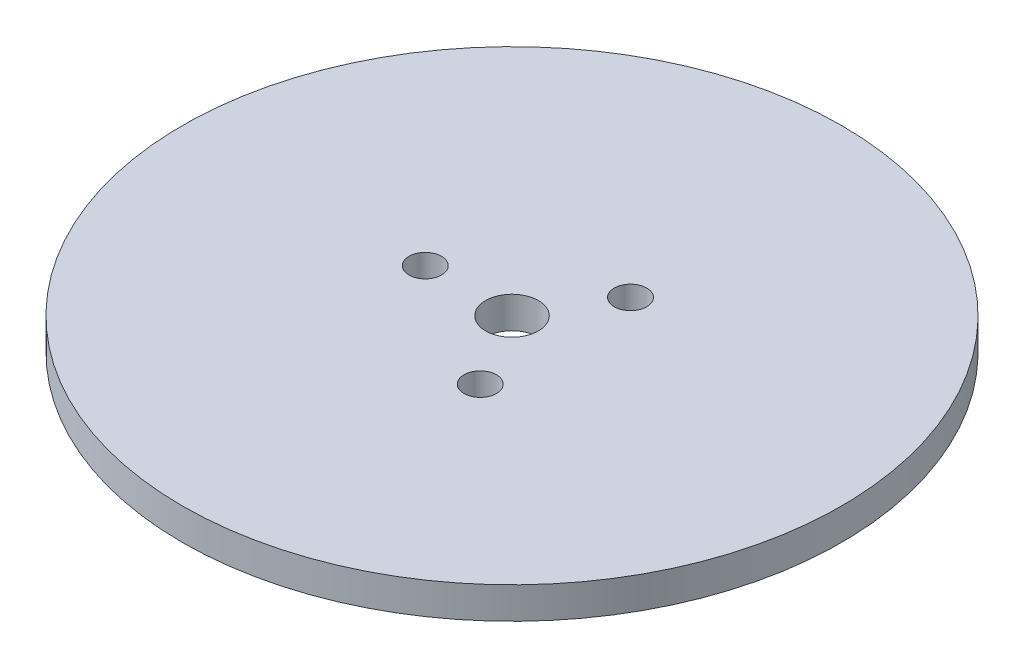
from build123d import *

# Parameters (mm, degrees)
SKETCH1_R           = 62.5
BOSS_EXTRUDE1_DEPTH = 6
SKETCH2_R           = 5
CUT_EXTRUDE1_DEPTH  = 89.591760339
SKETCH3_R           = 3.082357368
CUT_EXTRUDE2_DEPTH  = 4.412340898
CIRPATTERN1_COUNT   = 3


with BuildPart() as part:
    # Sketch1 → Boss-Extrude1 (new body)
    with BuildSketch(Plane(origin=(0, 0, 0), x_dir=(1, 0, 0), z_dir=(0, 1, 0))):
        Circle(SKETCH1_R)
    extrude(amount=BOSS_EXTRUDE1_DEPTH)

    # Sketch2 → Cut-Extrude1 (cut, through all)
    with BuildSketch(Plane(origin=(0, 0, 0), x_dir=(1, 0, 0), z_dir=(0, 1, 0))):
        Circle(SKETCH2_R)
    extrude(amount=CUT_EXTRUDE1_DEPTH, mode=Mode.SUBTRACT)

    # Sketch3 → Cut-Extrude2 (cut)
    with BuildSketch(Plane(origin=(0, 6, 0), x_dir=(1, 0, 0), z_dir=(0, 1, 0))):
        with Locations((-16.448886968, 0)):
            Circle(SKETCH3_R)
    cut_extrude2 = extrude(amount=-CUT_EXTRUDE2_DEPTH, mode=Mode.SUBTRACT)

    # CirPattern1: Cut-Extrude2 ×3 about axis
    cirpattern1_axis = Axis((0, 0, 0), (0, 1, 0))
    for i in range(1, CIRPATTERN1_COUNT):
        add(cut_extrude2.rotate(cirpattern1_axis, i * 360 / CIRPATTERN1_COUNT), mode=Mode.SUBTRACT)


solid = part.part
